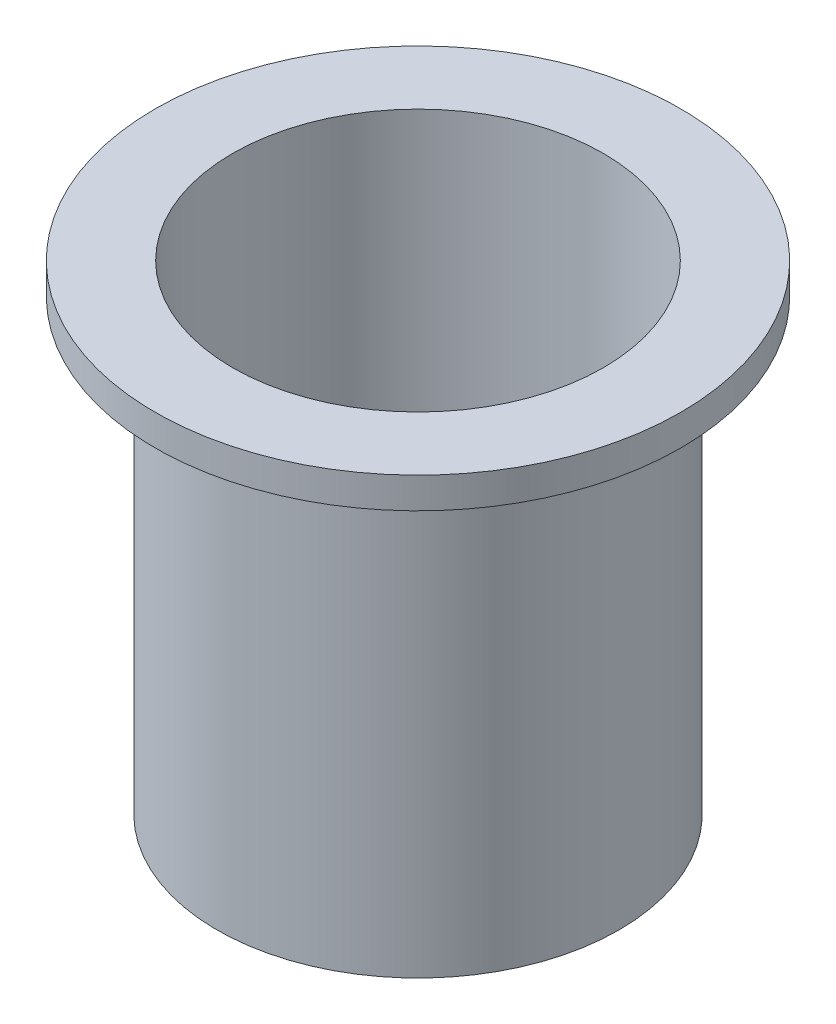
from build123d import *

# Parameters (mm, degrees)
SKETCH2_R          = 3.175
CUT_EXTRUDE1_DEPTH = 123.062130696
CIRPATTERN1_COUNT  = 6


with BuildPart() as part:
    # Sketch1 → Revolve1 (revolve)
    with BuildSketch(Plane.XY):
        Polygon((41.275, 0), (30.744042103, 0), (0, 0), (0, 3.175), (38.1, 3.175), (38.1, 98.425), (41.275, 98.425), (53.975, 98.425), (53.975, 92.075), (41.275, 92.075), align=None)
    revolve(axis=Axis((0, -554.392583441, 0), (0, 1, 0)))

    # Sketch2 → Cut-Extrude1 (cut, through all)
    with BuildSketch(Plane(origin=(0, 3.175, 0), x_dir=(1, 0, 0), z_dir=(0, 1, 0))):
        with Locations((0, 19.05)):
            Circle(SKETCH2_R)
    cut_extrude1 = extrude(amount=-CUT_EXTRUDE1_DEPTH, mode=Mode.SUBTRACT)

    # CirPattern1: Cut-Extrude1 ×6 about axis
    cirpattern1_axis = Axis((0, -554.392583441, 0), (0, -1, 0))
    for i in range(1, CIRPATTERN1_COUNT):
        add(cut_extrude1.rotate(cirpattern1_axis, i * 360 / CIRPATTERN1_COUNT), mode=Mode.SUBTRACT)


solid = part.part
